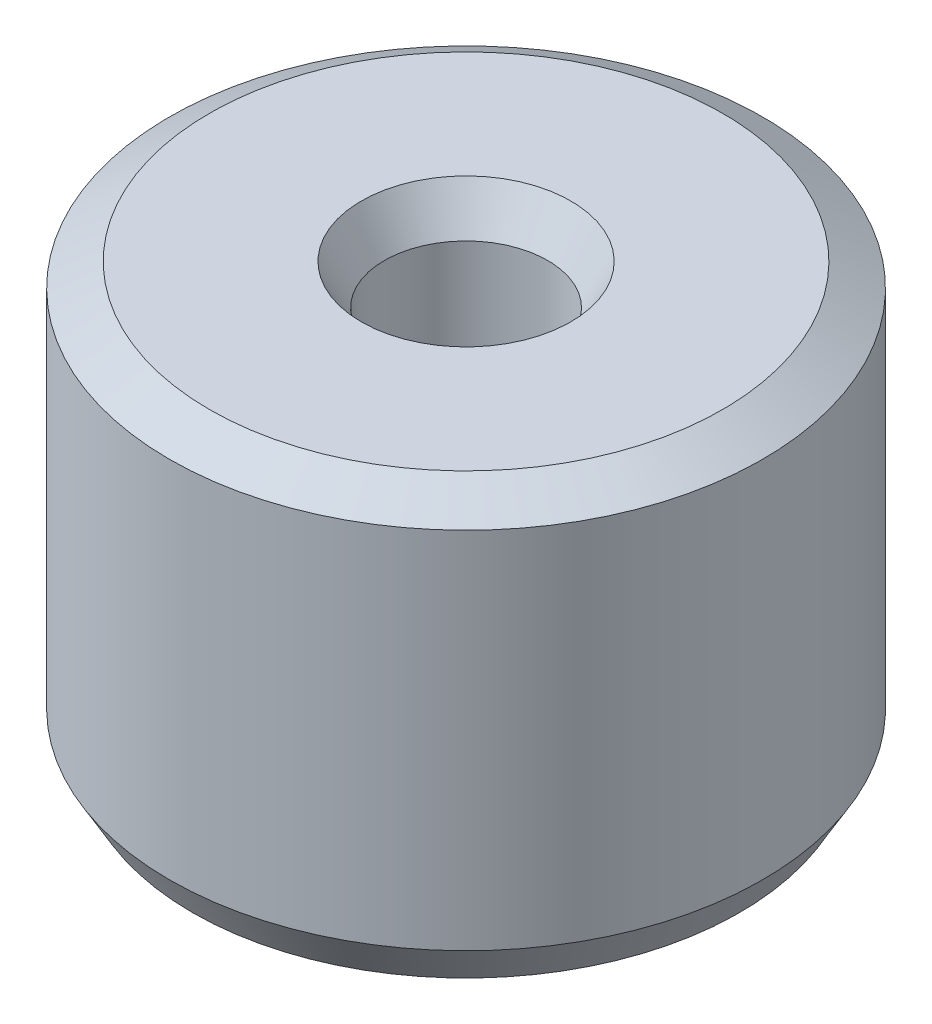
from build123d import *
from OCP.BRepFilletAPI import BRepFilletAPI_MakeChamfer

# Parameters (mm, degrees)
SKETCH1_R           = 5
BOSS_EXTRUDE1_DEPTH = 7.202814693
SKETCH2_R           = 1.37666703
CUT_EXTRUDE1_DEPTH  = 11.09358903
CHAMFER1_SIZE       = 0.389278257
CHAMFER1_SIZE2      = 0.674249719


with BuildPart() as part:
    # Sketch1 → Boss-Extrude1 (new body)
    with BuildSketch(Plane(origin=(0, 0, 0), x_dir=(1, 0, 0), z_dir=(0, 1, 0))):
        Circle(SKETCH1_R)
    extrude(amount=BOSS_EXTRUDE1_DEPTH)

    # Sketch2 → Cut-Extrude1 (cut, through all)
    with BuildSketch(Plane(origin=(0, 0, 0), x_dir=(1, 0, 0), z_dir=(0, 1, 0))):
        Circle(SKETCH2_R)
    extrude(amount=CUT_EXTRUDE1_DEPTH, mode=Mode.SUBTRACT)

    # Chamfer1: one chamfer whose edges measure the first distance from different faces: ONE call of the kernel's chamfer builder (chamfer() names one face for all edges)
    chamfer1_edges_1 = [part.edges().sort_by_distance(p)[0] for p in [
        (-1.37666703, 7.202814693, 0),
    ]]
    chamfer1_side_1 = [part.faces().sort_by_distance(p)[0] for p in [
        (-4.858578644, 7.202814693, 0),
    ]]
    chamfer1_edges_2 = [part.edges().sort_by_distance(p)[0] for p in [
        (-1.37666703, 0, 0),
    ]]
    chamfer1_side_2 = [part.faces().sort_by_distance(p)[0] for p in [
        (-1.37666703, 3.601407347, 0),
    ]]
    chamfer1_edges_3 = [part.edges().sort_by_distance(p)[0] for p in [
        (-5, 0, 0),
    ]]
    chamfer1_side_3 = [part.faces().sort_by_distance(p)[0] for p in [
        (-4.858578644, 0, 0),
    ]]
    chamfer1_edges_4 = [part.edges().sort_by_distance(p)[0] for p in [
        (-5, 7.202814693, 0),
    ]]
    chamfer1_side_4 = [part.faces().sort_by_distance(p)[0] for p in [
        (-5, 3.601407347, 0),
    ]]
    chamfer1 = BRepFilletAPI_MakeChamfer(part.part.solid().wrapped)
    for e in chamfer1_edges_1:
        chamfer1.Add(CHAMFER1_SIZE, CHAMFER1_SIZE2, e.wrapped, chamfer1_side_1[0].wrapped)  # the first distance lies on this face
    for e in chamfer1_edges_2:
        chamfer1.Add(CHAMFER1_SIZE, CHAMFER1_SIZE2, e.wrapped, chamfer1_side_2[0].wrapped)  # the first distance lies on this face
    for e in chamfer1_edges_3:
        chamfer1.Add(CHAMFER1_SIZE, CHAMFER1_SIZE2, e.wrapped, chamfer1_side_3[0].wrapped)  # the first distance lies on this face
    for e in chamfer1_edges_4:
        chamfer1.Add(CHAMFER1_SIZE, CHAMFER1_SIZE2, e.wrapped, chamfer1_side_4[0].wrapped)  # the first distance lies on this face
    add(Compound.cast(chamfer1.Shape()), mode=Mode.REPLACE)


solid = part.part
